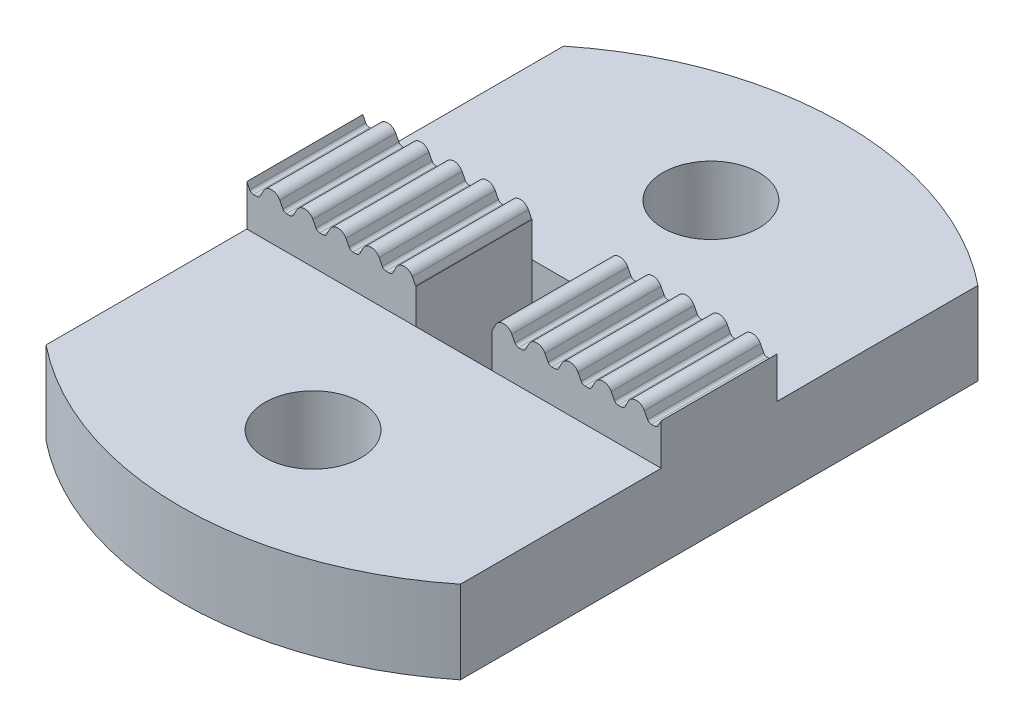
from build123d import *

# Parameters (mm, degrees)
BOSS_EXTRUDE1_DEPTH     = 7
BOSS_EXTRUDE2_START     = -2
SKETCH2_R               = 20
BOSS_EXTRUDE2_DEPTH     = 5
CUT_EXTRUDE2_DEPTH      = 46.034410177
CUT_EXTRUDE2_DEPTH_BACK = 46.034410177
SKETCH4_W               = 4.6
SKETCH4_H               = 7
M5_CLEARANCE_HOLE1_D    = 5.8
SKETCH7_OUTSIDE_W       = 53.42
SKETCH7_OUTSIDE_H       = 53.42
SKETCH7_OUTSIDE_W_2     = 25
SKETCH7_OUTSIDE_H_2     = 40
CUT_EXTRUDE3_DEPTH      = 46.430585512


with BuildPart() as part:
    # Sketch1 → Boss-Extrude1 (new body)
    with BuildSketch(Plane.XY):
        with BuildLine():
            Line((3.767777778, 0.135469288), (3.578888889, 0.501967566))
            ThreePointArc((3.578888889, 0.501967566), (3.09, 0.8), (2.601111111, 0.501967566))
            Line((2.601111111, 0.501967566), (2.412222222, 0.135469288))
            ThreePointArc((2.412222222, 0.135469288), (2.320129401, 0.036537266), (2.19, 0))
            Line((2.19, 0), (2.18, 0))
            Line((2.18, 0), (2, 0))
            Line((2, 0), (1.99, 0))
            ThreePointArc((1.99, 0), (1.859870599, 0.036537266), (1.767777778, 0.135469288))
            Line((1.767777778, 0.135469288), (1.578888889, 0.501967566))
            ThreePointArc((1.578888889, 0.501967566), (1.09, 0.8), (0.601111111, 0.501967566))
            Line((0.601111111, 0.501967566), (0.412222222, 0.135469288))
            ThreePointArc((0.412222222, 0.135469288), (0.320129401, 0.036537266), (0.19, 0))
            Line((0.19, 0), (0, 0))
            Line((0, 0), (0, -5))
            Line((0, -5), (36.18, -5))
            Line((36.18, -5), (36.18, 0))
            Line((36.18, 0), (35.99, 0))
            ThreePointArc((35.99, 0), (35.859870599, 0.036537266), (35.767777778, 0.135469288))
            Line((35.767777778, 0.135469288), (35.578888889, 0.501967566))
            ThreePointArc((35.578888889, 0.501967566), (35.09, 0.8), (34.601111111, 0.501967566))
            Line((34.601111111, 0.501967566), (34.412222222, 0.135469288))
            ThreePointArc((34.412222222, 0.135469288), (34.320129401, 0.036537266), (34.19, 0))
            Line((34.19, 0), (34.18, 0))
            Line((34.18, 0), (34, 0))
            Line((34, 0), (33.99, 0))
            ThreePointArc((33.99, 0), (33.859870599, 0.036537266), (33.767777778, 0.135469288))
            Line((33.767777778, 0.135469288), (33.578888889, 0.501967566))
            ThreePointArc((33.578888889, 0.501967566), (33.09, 0.8), (32.601111111, 0.501967566))
            Line((32.601111111, 0.501967566), (32.412222222, 0.135469288))
            ThreePointArc((32.412222222, 0.135469288), (32.320129401, 0.036537266), (32.19, 0))
            Line((32.19, 0), (32.18, 0))
            Line((32.18, 0), (32, 0))
            Line((32, 0), (31.99, 0))
            ThreePointArc((31.99, 0), (31.859870599, 0.036537266), (31.767777778, 0.135469288))
            Line((31.767777778, 0.135469288), (31.578888889, 0.501967566))
            ThreePointArc((31.578888889, 0.501967566), (31.09, 0.8), (30.601111111, 0.501967566))
            Line((30.601111111, 0.501967566), (30.412222222, 0.135469288))
            ThreePointArc((30.412222222, 0.135469288), (30.320129401, 0.036537266), (30.19, 0))
            Line((30.19, 0), (30.18, 0))
            Line((30.18, 0), (30, 0))
            Line((30, 0), (29.99, 0))
            ThreePointArc((29.99, 0), (29.859870599, 0.036537266), (29.767777778, 0.135469288))
            Line((29.767777778, 0.135469288), (29.578888889, 0.501967566))
            ThreePointArc((29.578888889, 0.501967566), (29.09, 0.8), (28.601111111, 0.501967566))
            Line((28.601111111, 0.501967566), (28.412222222, 0.135469288))
            ThreePointArc((28.412222222, 0.135469288), (28.320129401, 0.036537266), (28.19, 0))
            Line((28.19, 0), (28.18, 0))
            Line((28.18, 0), (28, 0))
            Line((28, 0), (27.99, 0))
            ThreePointArc((27.99, 0), (27.859870599, 0.036537266), (27.767777778, 0.135469288))
            Line((27.767777778, 0.135469288), (27.578888889, 0.501967566))
            ThreePointArc((27.578888889, 0.501967566), (27.09, 0.8), (26.601111111, 0.501967566))
            Line((26.601111111, 0.501967566), (26.412222222, 0.135469288))
            ThreePointArc((26.412222222, 0.135469288), (26.320129401, 0.036537266), (26.19, 0))
            Line((26.19, 0), (26.18, 0))
            Line((26.18, 0), (26, 0))
            Line((26, 0), (25.99, 0))
            ThreePointArc((25.99, 0), (25.859870599, 0.036537266), (25.767777778, 0.135469288))
            Line((25.767777778, 0.135469288), (25.578888889, 0.501967566))
            ThreePointArc((25.578888889, 0.501967566), (25.09, 0.8), (24.601111111, 0.501967566))
            Line((24.601111111, 0.501967566), (24.412222222, 0.135469288))
            ThreePointArc((24.412222222, 0.135469288), (24.320129401, 0.036537266), (24.19, 0))
            Line((24.19, 0), (24.18, 0))
            Line((24.18, 0), (24, 0))
            Line((24, 0), (23.99, 0))
            ThreePointArc((23.99, 0), (23.859870599, 0.036537266), (23.767777778, 0.135469288))
            Line((23.767777778, 0.135469288), (23.578888889, 0.501967566))
            ThreePointArc((23.578888889, 0.501967566), (23.09, 0.8), (22.601111111, 0.501967566))
            Line((22.601111111, 0.501967566), (22.412222222, 0.135469288))
            ThreePointArc((22.412222222, 0.135469288), (22.320129401, 0.036537266), (22.19, 0))
            Line((22.19, 0), (22.18, 0))
            Line((22.18, 0), (22, 0))
            Line((22, 0), (21.99, 0))
            ThreePointArc((21.99, 0), (21.859870599, 0.036537266), (21.767777778, 0.135469288))
            Line((21.767777778, 0.135469288), (21.578888889, 0.501967566))
            ThreePointArc((21.578888889, 0.501967566), (21.09, 0.8), (20.601111111, 0.501967566))
            Line((20.601111111, 0.501967566), (20.412222222, 0.135469288))
            ThreePointArc((20.412222222, 0.135469288), (20.320129401, 0.036537266), (20.19, 0))
            Line((20.19, 0), (20.18, 0))
            Line((20.18, 0), (20, 0))
            Line((20, 0), (19.99, 0))
            ThreePointArc((19.99, 0), (19.859870599, 0.036537266), (19.767777778, 0.135469288))
            Line((19.767777778, 0.135469288), (19.578888889, 0.501967566))
            ThreePointArc((19.578888889, 0.501967566), (19.09, 0.8), (18.601111111, 0.501967566))
            Line((18.601111111, 0.501967566), (18.412222222, 0.135469288))
            ThreePointArc((18.412222222, 0.135469288), (18.320129401, 0.036537266), (18.19, 0))
            Line((18.19, 0), (18.18, 0))
            Line((18.18, 0), (18, 0))
            Line((18, 0), (17.99, 0))
            ThreePointArc((17.99, 0), (17.859870599, 0.036537266), (17.767777778, 0.135469288))
            Line((17.767777778, 0.135469288), (17.578888889, 0.501967566))
            ThreePointArc((17.578888889, 0.501967566), (17.09, 0.8), (16.601111111, 0.501967566))
            Line((16.601111111, 0.501967566), (16.412222222, 0.135469288))
            ThreePointArc((16.412222222, 0.135469288), (16.320129401, 0.036537266), (16.19, 0))
            Line((16.19, 0), (16.18, 0))
            Line((16.18, 0), (16, 0))
            Line((16, 0), (15.99, 0))
            ThreePointArc((15.99, 0), (15.859870599, 0.036537266), (15.767777778, 0.135469288))
            Line((15.767777778, 0.135469288), (15.578888889, 0.501967566))
            ThreePointArc((15.578888889, 0.501967566), (15.09, 0.8), (14.601111111, 0.501967566))
            Line((14.601111111, 0.501967566), (14.412222222, 0.135469288))
            ThreePointArc((14.412222222, 0.135469288), (14.320129401, 0.036537266), (14.19, 0))
            Line((14.19, 0), (14.18, 0))
            Line((14.18, 0), (14, 0))
            Line((14, 0), (13.99, 0))
            ThreePointArc((13.99, 0), (13.859870599, 0.036537266), (13.767777778, 0.135469288))
            Line((13.767777778, 0.135469288), (13.578888889, 0.501967566))
            ThreePointArc((13.578888889, 0.501967566), (13.09, 0.8), (12.601111111, 0.501967566))
            Line((12.601111111, 0.501967566), (12.412222222, 0.135469288))
            ThreePointArc((12.412222222, 0.135469288), (12.320129401, 0.036537266), (12.19, 0))
            Line((12.19, 0), (12.18, 0))
            Line((12.18, 0), (12, 0))
            Line((12, 0), (11.99, 0))
            ThreePointArc((11.99, 0), (11.859870599, 0.036537266), (11.767777778, 0.135469288))
            Line((11.767777778, 0.135469288), (11.578888889, 0.501967566))
            ThreePointArc((11.578888889, 0.501967566), (11.09, 0.8), (10.601111111, 0.501967566))
            Line((10.601111111, 0.501967566), (10.412222222, 0.135469288))
            ThreePointArc((10.412222222, 0.135469288), (10.320129401, 0.036537266), (10.19, 0))
            Line((10.19, 0), (10.18, 0))
            Line((10.18, 0), (10, 0))
            Line((10, 0), (9.99, 0))
            ThreePointArc((9.99, 0), (9.859870599, 0.036537266), (9.767777778, 0.135469288))
            Line((9.767777778, 0.135469288), (9.578888889, 0.501967566))
            ThreePointArc((9.578888889, 0.501967566), (9.09, 0.8), (8.601111111, 0.501967566))
            Line((8.601111111, 0.501967566), (8.412222222, 0.135469288))
            ThreePointArc((8.412222222, 0.135469288), (8.320129401, 0.036537266), (8.19, 0))
            Line((8.19, 0), (8.18, 0))
            Line((8.18, 0), (8, 0))
            Line((8, 0), (7.99, 0))
            ThreePointArc((7.99, 0), (7.859870599, 0.036537266), (7.767777778, 0.135469288))
            Line((7.767777778, 0.135469288), (7.578888889, 0.501967566))
            ThreePointArc((7.578888889, 0.501967566), (7.09, 0.8), (6.601111111, 0.501967566))
            Line((6.601111111, 0.501967566), (6.412222222, 0.135469288))
            ThreePointArc((6.412222222, 0.135469288), (6.320129401, 0.036537266), (6.19, 0))
            Line((6.19, 0), (6.18, 0))
            Line((6.18, 0), (6, 0))
            Line((6, 0), (5.99, 0))
            ThreePointArc((5.99, 0), (5.859870599, 0.036537266), (5.767777778, 0.135469288))
            Line((5.767777778, 0.135469288), (5.578888889, 0.501967566))
            ThreePointArc((5.578888889, 0.501967566), (5.09, 0.8), (4.601111111, 0.501967566))
            Line((4.601111111, 0.501967566), (4.412222222, 0.135469288))
            ThreePointArc((4.412222222, 0.135469288), (4.320129401, 0.036537266), (4.19, 0))
            Line((4.19, 0), (4.18, 0))
            Line((4.18, 0), (4, 0))
            Line((4, 0), (3.99, 0))
            ThreePointArc((3.99, 0), (3.859870599, 0.036537266), (3.767777778, 0.135469288))
        make_face()
    extrude(amount=BOSS_EXTRUDE1_DEPTH)

    # Sketch2 → Boss-Extrude2 (add)
    with BuildSketch(Plane(origin=(0, 0, 0), x_dir=(1, 0, 0), z_dir=(0, 1, 0)).offset(BOSS_EXTRUDE2_START)):
        with Locations((18.09, -3.5)):
            Circle(SKETCH2_R)
    extrude(amount=-BOSS_EXTRUDE2_DEPTH)

    # Sketch4 → Cut-Extrude2 (cut, two sides: drawn at the far end of the back side and taken through both)
    with BuildSketch(Plane(origin=(0, -2, 0), x_dir=(1, 0, 0), z_dir=(0, 1, 0)).offset(-CUT_EXTRUDE2_DEPTH_BACK)):
        with Locations((18.09, -3.5)):
            Rectangle(SKETCH4_W, SKETCH4_H)
    extrude(amount=CUT_EXTRUDE2_DEPTH + CUT_EXTRUDE2_DEPTH_BACK, mode=Mode.SUBTRACT)

    # M5 Clearance Hole1 (through all)
    with Locations(Plane(origin=(18.09, -7, 15.5), x_dir=(0, 0, -1), z_dir=(0, -1, 0))):
        with Locations((0, 0), (24, 0)):
            Hole(M5_CLEARANCE_HOLE1_D / 2)

    # Sketch7 outside → Cut-Extrude3 (cut, through all)
    with BuildSketch(Plane.XZ.offset(7)):
        with Locations((18.09, 3.5)):
            Rectangle(SKETCH7_OUTSIDE_W, SKETCH7_OUTSIDE_H)
        with Locations((18.09, 3.5)):
            Rectangle(SKETCH7_OUTSIDE_W_2, SKETCH7_OUTSIDE_H_2, mode=Mode.SUBTRACT)
    extrude(amount=-CUT_EXTRUDE3_DEPTH, mode=Mode.SUBTRACT)


solid = part.part
